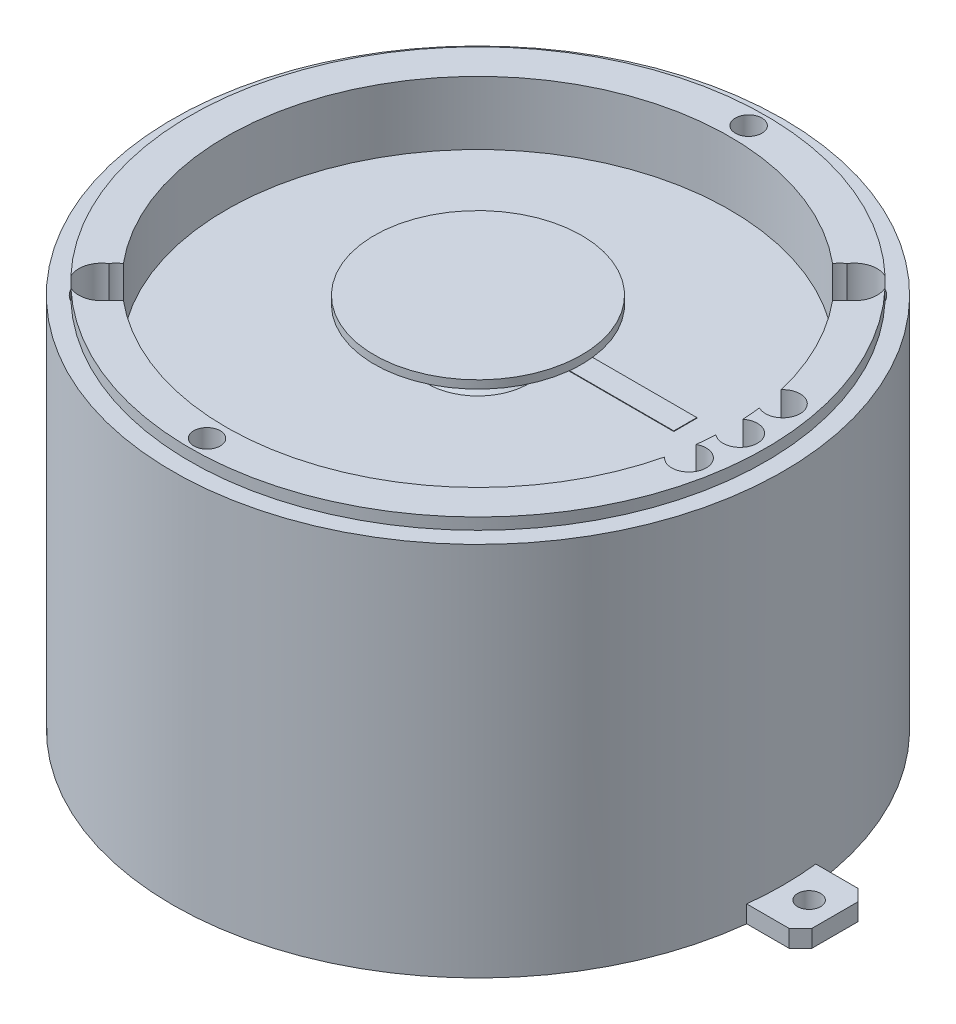
from build123d import *

# Parameters (mm, degrees)
SKETCH_2_R              = 1
EXTRUDE_1_DEPTH         = 1.5
SKETCH_4_R              = 3.5
CUT_EXTRUDE_1_DEPTH     = 2
HOLE_WIZARD_M2_21_D     = 2.3
HOLE_WIZARD_M2_21_DEPTH = 10
HOLE_WIZARD_M2_21_TIP   = 0.690989712
HOLE_WIZARD_M2_22_D     = 2.3
HOLE_WIZARD_M2_22_DEPTH = 10
HOLE_WIZARD_M2_22_TIP   = 0.690989712
SKETCH_18_R             = 2
CUT_EXTRUDE_3_DEPTH     = 5.5
HOLE_WIZARD_M2_23_D     = 2.3
HOLE_WIZARD_M2_23_DEPTH = 15
HOLE_WIZARD_M2_23_TIP   = 0.690989712
CUT_EXTRUDE_START       = -5.5
SKETCH_20_R             = 1.5
CUT_EXTRUDE_4_DEPTH     = 5.5
SKETCH_8_W              = 2
SKETCH_8_H              = 0.05
EXTRUDE_3_DEPTH         = 18
SKETCH_9_R              = 2
CUT_EXTRUDE_2_DEPTH     = 5.5


# Read off the part's stored shape, not the designer's step: Повернуть1
with BuildPart() as part:
    # Повернуть1 outline → Повернуть1 (revolve)
    with BuildSketch(Plane.XY):
        Polygon((0, 26.1), (0, 0), (15, 0), (15, -2), (26.5, -2), (26.5, 30.6), (25, 30.6), (25, 31.6), (21.858230866, 31.6), (21.858230866, 26.1), align=None)
    revolve(axis=Axis((0, 0, 0), (0, 1, 0)))

    # Эскиз2 → Бобышка-Вытянуть1 (add)
    # profile 1 of 2: a face of its own
    with BuildSketch(Plane.XZ.offset(2)):
        Polygon((-31, -2), (-31, 2), (-30, 3), (-26.329641091, 3), (-26.329641091, -3), (-30, -3), align=None)
        with Locations(Location((-28.75, 0, 0), (0, 0, 270))):
            Circle(SKETCH_2_R, mode=Mode.SUBTRACT)
    # profile 2 of 2: a face of its own
    with BuildSketch(Plane.XZ.offset(2)):
        Polygon((30, 3), (26.329641091, 3), (26.329641091, -3), (30, -3), (31, -2), (31, 2), align=None)
        with Locations(Location((28.75, 0, 0), (0, 0, 90))):
            Circle(SKETCH_2_R, mode=Mode.SUBTRACT)
    extrude(amount=-EXTRUDE_1_DEPTH)

    # Эскиз4 → Вырез-Вытянуть1 (cut)
    with BuildSketch(Plane.XZ):
        with Locations(Location((0, 0, 0), (0, 0, 270))):
            Circle(SKETCH_4_R)
    extrude(amount=-CUT_EXTRUDE_1_DEPTH, mode=Mode.SUBTRACT)

    # Эскиз7 → Повернуть2 (revolve)
    with BuildSketch(Plane.XY, mode=Mode.PRIVATE) as revolve_2_sk:
        with BuildLine():
            Line((-1.963060758, 29.900525332), (-9, 29.900525332))
            Line((-9, 29.900525332), (-9, 30.6))
            Line((-9, 30.6), (0, 30.6))
            Line((0, 30.6), (0, 26.1))
            Line((0, 26.1), (-4.353608906, 26.1))
            add(Edge.make_bspline(
                [(-1.963060758, 29.900525332), (-2.24555005, 27.574534407), (-4.353608906, 26.1)],
                knots=[0, 0, 0, 1, 1, 1], degree=2))
        make_face()
    revolve(revolve_2_sk.sketch.rotate(Axis((0, 26.1, 0), (0, 1, 0)), 270), axis=Axis((0, 26.1, 0), (0, 1, 0)))

    # Сверло под метчик  спиральное M2.21
    with Locations(Plane(origin=(0, 31.6, 0), x_dir=(1, 0, 0), z_dir=(0, 1, 0))):
        with Locations((0, -23.523355069)):
            Hole(HOLE_WIZARD_M2_21_D / 2, depth=HOLE_WIZARD_M2_21_DEPTH)
            with Locations((0, 0, -(HOLE_WIZARD_M2_21_DEPTH + HOLE_WIZARD_M2_21_TIP / 2))):  # 118° drill point
                Cone(0, HOLE_WIZARD_M2_21_D / 2, HOLE_WIZARD_M2_21_TIP, mode=Mode.SUBTRACT)

    # Сверло под метчик  спиральное M2.22
    with Locations(Plane(origin=(0, 31.6, -23.5), x_dir=(0, 0, 1), z_dir=(0, 1, 0))):
        with Locations((0, 0)):
            Hole(HOLE_WIZARD_M2_22_D / 2, depth=HOLE_WIZARD_M2_22_DEPTH)
            with Locations((0, 0, -(HOLE_WIZARD_M2_22_DEPTH + HOLE_WIZARD_M2_22_TIP / 2))):  # 118° drill point
                Cone(0, HOLE_WIZARD_M2_22_D / 2, HOLE_WIZARD_M2_22_TIP, mode=Mode.SUBTRACT)

    # Эскиз18 → Вырез-Вытянуть3 (cut)
    with BuildSketch(Plane(origin=(0, 31.6, 0), x_dir=(1, 0, 0), z_dir=(0, 1, 0))):
        with Locations((15.708448043, 15.708448043)):
            Circle(SKETCH_18_R)
        with Locations((-15.708448043, -15.708448043)):
            Circle(SKETCH_18_R)
    extrude(amount=-CUT_EXTRUDE_3_DEPTH, mode=Mode.SUBTRACT)

    # Сверло под метчик  спиральное M2.23
    with Locations(Plane(origin=(-15.708448043, 31.6, 15.708448043), x_dir=(0, 0, 1), z_dir=(0, 1, 0))):
        with Locations((0, 0), (-31.416896086, 31.416896086)):
            Hole(HOLE_WIZARD_M2_23_D / 2, depth=HOLE_WIZARD_M2_23_DEPTH)
            with Locations((0, 0, -(HOLE_WIZARD_M2_23_DEPTH + HOLE_WIZARD_M2_23_TIP / 2))):  # 118° drill point
                Cone(0, HOLE_WIZARD_M2_23_D / 2, HOLE_WIZARD_M2_23_TIP, mode=Mode.SUBTRACT)

    # Эскиз20 → Вырез-Вытянуть4 (cut)
    with BuildSketch(Plane(origin=(0, 31.6, 0), x_dir=(1, 0, 0), z_dir=(0, 1, 0)).offset(CUT_EXTRUDE_START)):
        with Locations((22.760809842, 0)):
            Circle(SKETCH_20_R)
        with Locations((22.393028951, 4.075134238)):
            Circle(SKETCH_20_R)
        with Locations((22.393028951, -4.075134238)):
            Circle(SKETCH_20_R)
    extrude(amount=CUT_EXTRUDE_4_DEPTH, mode=Mode.SUBTRACT)

    # Эскиз8 → Бобышка-Вытянуть3 (add)
    with BuildSketch(Plane(origin=(0, 0, 0), x_dir=(0, 0, -1), z_dir=(1, 0, 0))):
        with Locations((0, 29.875525332)):
            Rectangle(SKETCH_8_W, SKETCH_8_H)
    extrude(amount=EXTRUDE_3_DEPTH)

    # Эскиз9 → Вырез-Вытянуть2 (cut)
    with BuildSketch(Plane(origin=(0, 31.6, 0), x_dir=(1, 0, 0), z_dir=(0, 1, 0)).offset(CUT_EXTRUDE_START)):
        with Locations((-16.330009516, -16.330009516)):
            Circle(SKETCH_9_R)
        with Locations((16.330009516, 16.330009516)):
            Circle(SKETCH_9_R)
    extrude(amount=CUT_EXTRUDE_2_DEPTH, mode=Mode.SUBTRACT)


solid = part.part
